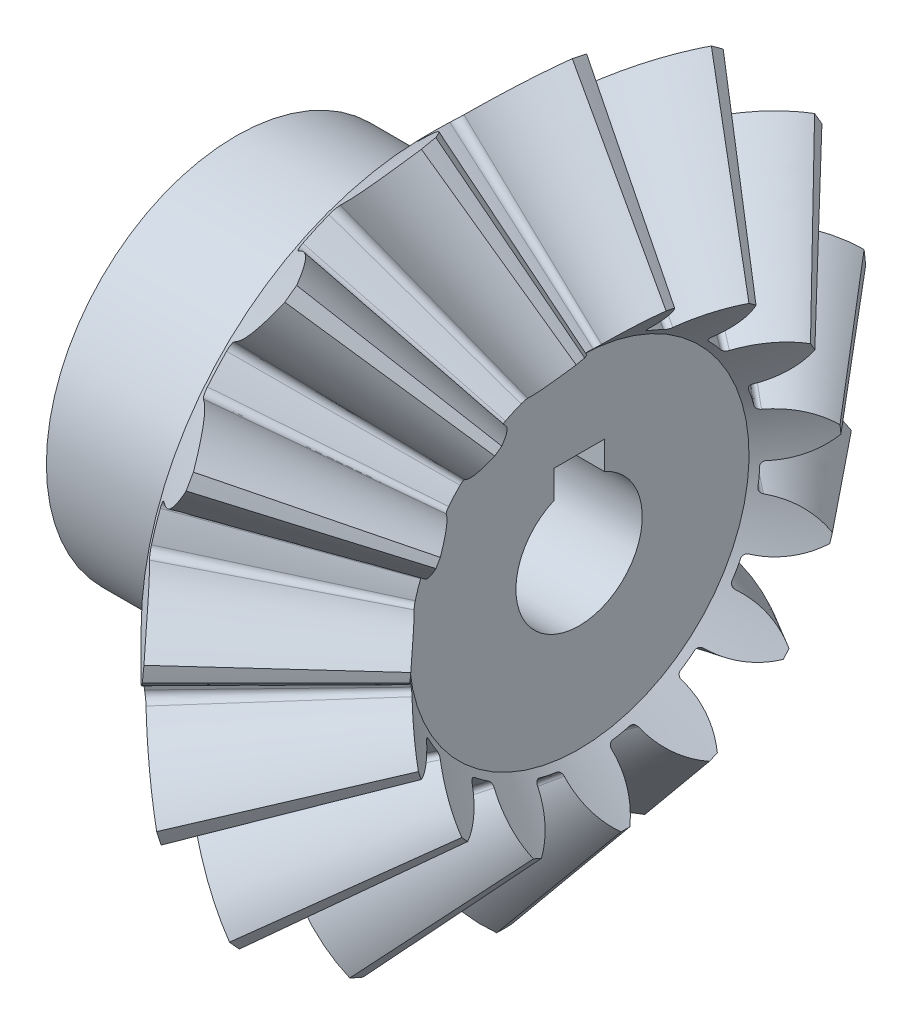
from build123d import *

# Parameters (mm, degrees)
TEETHCUTS_COUNT = 15
TEETHCUTS_ANGLE = 336
HUBSKE_R        = 15
HUB_DEPTH       = 15.074030221
BORSKE_R        = 5
BORE_DEPTH      = 45.0000508
KEYSKE_W        = 4
KEYSKE_H        = 6.8
KEYWAY_DEPTH    = 45.0000508


with BuildPart() as part:
    # BasProSke → Base-Revolve (revolve)
    with BuildSketch(Plane(origin=(0, 0, 0), x_dir=(1, 0, 0), z_dir=(0, 1, 0)), mode=Mode.PRIVATE) as base_revolve_sk:
        Polygon((0, 0), (0, 22.573928625), (6.150945118, 28.724873732), (15.757546825, 17.118272005), (12.091958854, 13.45268404), (12.091958854, 0), align=None)
    revolve(base_revolve_sk.sketch.rotate(Axis((-10, 0, 0), (1, 0, 0)), 180), axis=Axis((-10, 0, 0), (1, 0, 0)))

    # ToothCut: read off the stored shape, not the designer's step
    # ToothCut: loft between two sections, ruled curve by curve
    toothcut_from = [
        Edge.make_bspline([(29.931775955, 0.005704573, -0.009808423), (29.927668745, 0.001597363, -0.014585945), (29.922379416, -0.003691966, -0.013805513), (29.919057984, -0.007013398, -0.007931907)], [0, 0, 0, 0, 1, 1, 1, 1], 3, [1, 0.80148616, 0.80148616, 1]),
        Edge.make_bspline([(29.919057984, -0.007013398, 0.007931907), (29.922379416, -0.003691966, 0.013805513), (29.927668745, 0.001597363, 0.014585945), (29.931775955, 0.005704573, 0.009808423)], [0, 0, 0, 0, 1, 1, 1, 1], 3, [1, 0.80148616, 0.80148616, 1]),
        Edge.make_bspline([(29.919057984, -0.007013398, -0.007931907), (29.918500554, -0.007570828, -0.006946151), (29.918052413, -0.008018969, -0.005854587), (29.917723429, -0.008347953, -0.004681254)], [0, 0, 0, 0, 1, 1, 1, 1], 3, [1, 0.992659686, 0.992659686, 1]),
        Edge.make_bspline([(29.917723429, -0.008347953, 0.004681254), (29.918052413, -0.008018969, 0.005854587), (29.918500554, -0.007570828, 0.006946151), (29.919057984, -0.007013398, 0.007931907)], [0, 0, 0, 0, 1, 1, 1, 1], 3, [1, 0.992659686, 0.992659686, 1]),
        Edge.make_bspline([(29.917723429, -0.008347953, -0.004681254), (29.916869945, -0.009201437, -0.001637275), (29.916869945, -0.009201437, 0.001637275), (29.917723429, -0.008347953, 0.004681254)], [0, 0, 0, 0, 1, 1, 1, 1], 3, [1, 0.95305802, 0.95305802, 1]),
        Edge.make_line((29.931775955, 0.005704573, 0.009808423), (29.931775955, 0.005704573, -0.009808423)),
    ]
    toothcut_to = [
        Edge.make_bspline([(6.163263879, 28.737192492, -5.892338304), (4.926793949, 27.500722565, -3.593604273), (3.153496434, 25.727425053, -2.1608706), (1.125317817, 23.699246439, -1.82193562)], [0, 0, 0, 0, 1, 1, 1, 1], 3, [1, 0.94700147, 0.94700147, 1]),
        Edge.make_bspline([(1.125317817, 23.699246439, 1.82193562), (3.153496434, 25.727425053, 2.1608706), (4.926793949, 27.500722565, 3.593604273), (6.163263879, 28.737192492, 5.892338304)], [0, 0, 0, 0, 1, 1, 1, 1], 3, [1, 0.94700147, 0.94700147, 1]),
        Edge.make_bspline([(1.125317817, 23.699246439, -1.82193562), (0.868274432, 23.442203055, -1.778980333), (0.70134894, 23.275277564, -1.499231301), (0.714631719, 23.288560342, -1.133670232)], [0, 0, 0, 0, 1, 1, 1, 1], 3, [1, 0.820098625, 0.820098625, 1]),
        Edge.make_bspline([(0.714631719, 23.288560342, 1.133670232), (0.70134894, 23.275277564, 1.499231301), (0.868274432, 23.442203055, 1.778980333), (1.125317817, 23.699246439, 1.82193562)], [0, 0, 0, 0, 1, 1, 1, 1], 3, [1, 0.820098625, 0.820098625, 1]),
        Edge.make_bspline([(0.714631719, 23.288560342, -1.133670232), (0.742081161, 23.316009784, -0.37822232), (0.742081161, 23.316009784, 0.37822232), (0.714631719, 23.288560342, 1.133670232)], [0, 0, 0, 0, 1, 1, 1, 1], 3, [1, 0.999121569, 0.999121569, 1]),
        Edge.make_line((6.163263879, 28.737192492, 5.892338304), (6.163263879, 28.737192492, -5.892338304)),
    ]
    toothcut = Solid(Shell([*[Face.make_surface_from_curves(toothcut_from[k], toothcut_to[k]) for k in range(6)], Face(Wire(toothcut_from)), Face(Wire(toothcut_to))]))
    add(toothcut, mode=Mode.SUBTRACT)

    # TeethCuts: ToothCut ×15 about axis
    teethcuts_axis = Axis((-10, 0, 0), (1, 0, 0))
    for i in range(1, TEETHCUTS_COUNT):
        add(toothcut.rotate(teethcuts_axis, i * TEETHCUTS_ANGLE / (TEETHCUTS_COUNT - 1)), mode=Mode.SUBTRACT)

    # HubSke → Hub (add)
    with BuildSketch(Plane.ZY):
        with Locations(Location((0, 0, 0), (0, 0, 180))):
            Circle(HUBSKE_R)
    extrude(amount=HUB_DEPTH)

    # BorSke → Bore (cut, symmetric)
    with BuildSketch(Plane(origin=(0, 0, 0), x_dir=(0, 0, -1), z_dir=(1, 0, 0))):
        with Locations(Location((0, 0, 0), (0, 0, 180))):
            Circle(BORSKE_R)
    extrude(amount=BORE_DEPTH, both=True, mode=Mode.SUBTRACT)

    # KeySke → Keyway (cut, symmetric)
    with BuildSketch(Plane(origin=(0, 0, 0), x_dir=(0, 0, -1), z_dir=(1, 0, 0))):
        with Locations((0, 3.4)):
            Rectangle(KEYSKE_W, KEYSKE_H)
    extrude(amount=KEYWAY_DEPTH, both=True, mode=Mode.SUBTRACT)


solid = part.part
